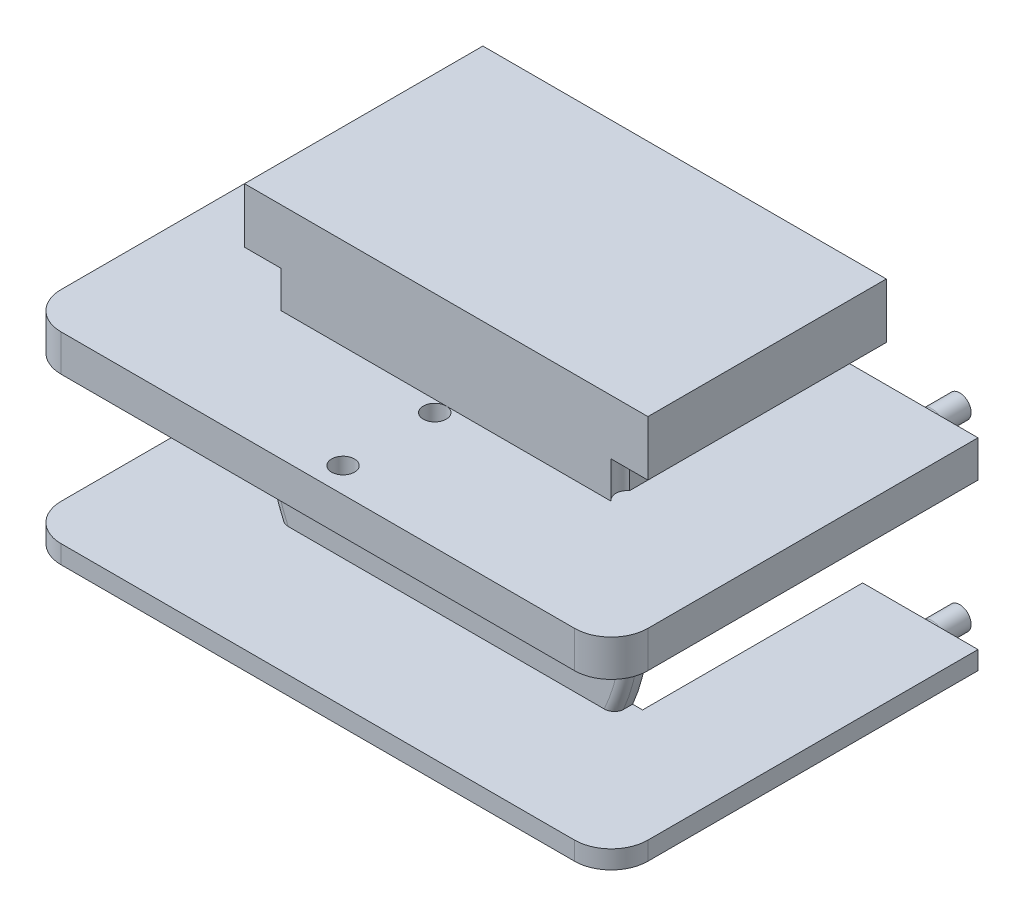
from build123d import *

# Parameters (mm, degrees)
BOSS_EXTRUDE1_DEPTH     = 1
SKETCH2_R               = 1.475
BOSS_EXTRUDE2_DEPTH     = 14
SKETCH3_R               = 1.8
BOSS_EXTRUDE3_DEPTH     = 0.75
SKETCH4_W               = 2
SKETCH4_H               = 17
BOSS_EXTRUDE4_DEPTH     = 12
SKETCH5_W               = 18
SKETCH5_H               = 2
BOSS_EXTRUDE5_DEPTH     = 12
SKETCH6_W               = 13
SKETCH6_H               = 2
BOSS_EXTRUDE6_DEPTH     = 5
BOSS_EXTRUDE7_DEPTH     = 12
CUT_EXTRUDE1_DEPTH      = 24.366642891
SKETCH9_W               = 2.937742252
SKETCH9_H               = 8
CUT_EXTRUDE2_DEPTH      = 12
CUT_EXTRUDE11_START     = -12
SKETCH21_R              = 10.5
SKETCH21_R_2            = 1.8
CUT_EXTRUDE11_DEPTH     = 12
SKETCH10_W              = 32
SKETCH10_H              = 2
BOSS_EXTRUDE8_DEPTH     = 7
FILLET1_R               = 0.5
SKETCH11_R              = 0.625
BOSS_EXTRUDE9_DEPTH     = 2
SKETCH14_W              = 2
SKETCH14_H              = 2
CUT_EXTRUDE5_DEPTH      = 28.874719859
SKETCH12_R              = 0.675
CUT_EXTRUDE3_DEPTH      = 2.5
CUT_EXTRUDE6_DEPTH      = 2
FILLET2_R               = 0.5
FILLET3_R               = 0.5
FILLET4_R               = 2
CUT_EXTRUDE7_DEPTH      = 28.221315288
CUT_EXTRUDE7_DEPTH_BACK = 1
SKETCH19_R              = 0.625
CUT_EXTRUDE9_DEPTH      = 2
FILLET5_R               = 0.4


with BuildPart() as part:
    # Sketch1 → Boss-Extrude1 (new body)
    with BuildSketch(Plane.XY):
        Polygon((-11, 6), (-11, 11), (11, 11), (11, 6), (11, -6), (-11, -6), align=None)
    extrude(amount=BOSS_EXTRUDE1_DEPTH)

    # Sketch2 → Boss-Extrude2 (add)
    with BuildSketch(Plane(origin=(0, 0, 0), x_dir=(-1, 0, 0), z_dir=(0, 0, -1))):
        with Locations(Location((0, 0, 0), (0, 0, 180))):
            Circle(SKETCH2_R)
    extrude(amount=BOSS_EXTRUDE2_DEPTH)

    # Sketch3 → Boss-Extrude3 (add)
    with BuildSketch(Plane(origin=(0, 0, 0), x_dir=(-1, 0, 0), z_dir=(0, 0, -1))):
        with Locations(Location((0, 0, 0), (0, 0, 180))):
            Circle(SKETCH3_R)
    extrude(amount=BOSS_EXTRUDE3_DEPTH)

    # Sketch4 → Boss-Extrude4 (add)
    with BuildSketch(Plane(origin=(0, 0, 0), x_dir=(-1, 0, 0), z_dir=(0, 0, -1))):
        with Locations((10, 2.5)):
            Rectangle(SKETCH4_W, SKETCH4_H)
        with Locations((-10, 2.5)):
            Rectangle(SKETCH4_W, SKETCH4_H)
    extrude(amount=BOSS_EXTRUDE4_DEPTH)

    # Sketch5 → Boss-Extrude5 (add)
    with BuildSketch(Plane(origin=(0, 0, 0), x_dir=(-1, 0, 0), z_dir=(0, 0, -1))):
        with Locations((0, 10)):
            Rectangle(SKETCH5_W, SKETCH5_H)
    extrude(amount=BOSS_EXTRUDE5_DEPTH)

    # Sketch6 → Boss-Extrude6 (add)
    with BuildSketch(Plane(origin=(11, 0, 0), x_dir=(0, 0, -1), z_dir=(1, 0, 0))):
        with Locations((5.5, -5)):
            Rectangle(SKETCH6_W, SKETCH6_H)
        with Locations((5.5, 5)):
            Rectangle(SKETCH6_W, SKETCH6_H)
    boss_extrude6 = extrude(amount=BOSS_EXTRUDE6_DEPTH)

    # Mirror1: Boss-Extrude6 across plane
    add(boss_extrude6.mirror(Plane(origin=(0, 0, 0), x_dir=(0, 0, 1), z_dir=(1, 0, 0))))

    # Sketch7 → Boss-Extrude7 (add)
    with BuildSketch(Plane(origin=(0, 0, -12), x_dir=(-1, 0, 0), z_dir=(0, 0, -1))):
        with BuildLine():
            ThreePointArc((-6.708203932, -6), (-8.407551231, -3.211398808), (-9, 0))
            Line((-9, 0), (-9, -6))
            Line((-9, -6), (-6.708203932, -6))
        make_face()
        with BuildLine():
            Line((-9, 9), (-9, 0))
            ThreePointArc((-9, 0), (-6.363961031, 6.363961031), (0, 9))
            Line((0, 9), (-9, 9))
        make_face()
    boss_extrude7 = extrude(amount=-BOSS_EXTRUDE7_DEPTH)

    # Sketch8 → Cut-Extrude1 (cut, through all)
    with BuildSketch(Plane(origin=(0, 0, -12), x_dir=(-1, 0, 0), z_dir=(0, 0, -1))):
        with BuildLine():
            Line((-11, 4), (-9.16515139, 4))
            ThreePointArc((-9.16515139, 4), (-10, 0), (-9.16515139, -4))
            Line((-9.16515139, -4), (-11, -4))
            Line((-11, -4), (-11, 4))
        make_face()
    cut_extrude1 = extrude(amount=-CUT_EXTRUDE1_DEPTH, mode=Mode.SUBTRACT)

    # Sketch9 → Cut-Extrude2 (cut)
    with BuildSketch(Plane(origin=(0, 0, -12), x_dir=(-1, 0, 0), z_dir=(0, 0, -1))):
        with Locations((-9.531128874, 0)):
            Rectangle(SKETCH9_W, SKETCH9_H)
    cut_extrude2 = extrude(amount=-CUT_EXTRUDE2_DEPTH, mode=Mode.SUBTRACT)

    # Mirror2: Boss-Extrude7, Cut-Extrude1, Cut-Extrude2 across plane
    add(boss_extrude7.mirror(Plane(origin=(0, 0, 0), x_dir=(0, 0, 1), z_dir=(1, 0, 0))))
    add(cut_extrude1.mirror(Plane(origin=(0, 0, 0), x_dir=(0, 0, 1), z_dir=(1, 0, 0))), mode=Mode.SUBTRACT)
    add(cut_extrude2.mirror(Plane(origin=(0, 0, 0), x_dir=(0, 0, 1), z_dir=(1, 0, 0))), mode=Mode.SUBTRACT)

    # Sketch21 → Cut-Extrude11 (cut)
    with BuildSketch(Plane(origin=(0, 0, -12), x_dir=(-1, 0, 0), z_dir=(0, 0, -1)).offset(CUT_EXTRUDE11_START)):
        Circle(SKETCH21_R)
        with Locations(Location((0, 0, 0), (0, 0, 180))):
            Circle(SKETCH21_R_2, mode=Mode.SUBTRACT)
    extrude(amount=CUT_EXTRUDE11_DEPTH, mode=Mode.SUBTRACT)

    # Sketch10 → Boss-Extrude8 (add)
    with BuildSketch(Plane.XY.offset(1)):
        with Locations((0, -5)):
            Rectangle(SKETCH10_W, SKETCH10_H)
        with Locations((0, 5)):
            Rectangle(SKETCH10_W, SKETCH10_H)
    extrude(amount=BOSS_EXTRUDE8_DEPTH)

    # Fillet1
    fillet1_edges = [part.edges().sort_by_distance(p)[0] for p in [
        (10, 0, 1),
        (-10, 0, 1),
    ]]
    fillet(fillet1_edges, radius=FILLET1_R)

    # Sketch11 → Boss-Extrude9 (add)
    with BuildSketch(Plane(origin=(0, 0, -12), x_dir=(-1, 0, 0), z_dir=(0, 0, -1))):
        with Locations(Location((-13, -5, 0), (0, 0, 180))):
            Circle(SKETCH11_R)
    boss_extrude9 = extrude(amount=BOSS_EXTRUDE9_DEPTH)

    # Sketch14 → Cut-Extrude5 (cut, through all)
    with BuildSketch(Plane(origin=(0, 0, -12), x_dir=(-1, 0, 0), z_dir=(0, 0, -1))):
        with Locations((10, 7)):
            Rectangle(SKETCH14_W, SKETCH14_H)
        with Locations((-10, 7)):
            Rectangle(SKETCH14_W, SKETCH14_H)
    extrude(amount=-CUT_EXTRUDE5_DEPTH, mode=Mode.SUBTRACT)

    # Sketch12 → Cut-Extrude3 (cut)
    with BuildSketch(Plane(origin=(0, 0, -12), x_dir=(-1, 0, 0), z_dir=(0, 0, -1))):
        with Locations((13, -5)):
            Circle(SKETCH12_R)
    cut_extrude3 = extrude(amount=-CUT_EXTRUDE3_DEPTH, mode=Mode.SUBTRACT)

    # Sketch16 → Cut-Extrude6 (cut)
    with BuildSketch(Plane(origin=(0, 6, 0), x_dir=(1, 0, 0), z_dir=(0, 1, 0))):
        with BuildLine():
            Line((-9, 0), (-9, -1))
            ThreePointArc((-9, -1), (-8.75, -0.5), (-9, 0))
        make_face()
    cut_extrude6 = extrude(amount=CUT_EXTRUDE6_DEPTH, mode=Mode.SUBTRACT)

    # Mirror3: Boss-Extrude9, Cut-Extrude3 across plane
    add(boss_extrude9.mirror(Plane.ZX))
    add(cut_extrude3.mirror(Plane.ZX), mode=Mode.SUBTRACT)

    # Mirror4: Cut-Extrude6 across plane
    add(cut_extrude6.mirror(Plane(origin=(0, 0, 0), x_dir=(0, 0, 1), z_dir=(1, 0, 0))), mode=Mode.SUBTRACT)

    # Fillet2
    fillet2_edges = [part.edges().sort_by_distance(p)[0] for p in [
        (12.375, -5, -12),
        (12.375, 5, -12),
    ]]
    fillet(fillet2_edges, radius=FILLET2_R)

    # Fillet3
    # the kernel refuses this fillet: 0.5 mm, written as the material it takes off along each edge
    with BuildSketch(Plane(origin=(-13, -5, -12), x_dir=(-1, 0, 0), z_dir=(0, -1, 0))) as fillet3_piece_1:
        with BuildLine():
            CenterArc((0.675 + FILLET3_R, -FILLET3_R), FILLET3_R, 90, 90)
            Line((0.675, -FILLET3_R), (0.675, 0))
            Line((0.675, 0), (0.675 + FILLET3_R, 0))
        make_face()
    revolve(axis=Axis((-13, -5, -12), (0, 0, -1)), mode=Mode.SUBTRACT)
    with BuildSketch(Plane(origin=(-13, 5, -12), x_dir=(-1, 0, 0), z_dir=(0, 1, 0))) as fillet3_piece_2:
        with BuildLine():
            CenterArc((0.675 + FILLET3_R, FILLET3_R), FILLET3_R, 180, 90)
            Line((0.675, FILLET3_R), (0.675, 0))
            Line((0.675, 0), (0.675 + FILLET3_R, 0))
        make_face()
    revolve(axis=Axis((-13, 5, -12), (0, 0, 1)), mode=Mode.SUBTRACT)

    # Fillet4
    fillet4_edges = [part.edges().sort_by_distance(p)[0] for p in [
        (16, -5, 8),
        (-16, -5, 8),
        (-16, 5, 8),
        (16, 5, 8),
    ]]
    fillet(fillet4_edges, radius=FILLET4_R)

    # Sketch17 → Cut-Extrude7 (cut, two sides: drawn at the far end of the back side and taken through both)
    with BuildSketch(Plane.XZ.offset(6).offset(-CUT_EXTRUDE7_DEPTH_BACK)):
        with BuildLine():
            Line((-16, 6), (-16, -12))
            Line((-16, -12), (-14.5, -12))
            Line((-14.5, -12), (-14.5, 6))
            ThreePointArc((-14.5, 6), (-14.353553391, 6.353553391), (-14, 6.5))
            Line((-14, 6.5), (14, 6.5))
            ThreePointArc((14, 6.5), (14.353553391, 6.353553391), (14.5, 6))
            Line((14.5, 6), (14.5, -12))
            Line((14.5, -12), (16, -12))
            Line((16, -12), (16, 6))
            ThreePointArc((16, 6), (15.414213562, 7.414213562), (14, 8))
            Line((14, 8), (-14, 8))
            ThreePointArc((-14, 8), (-15.414213562, 7.414213562), (-16, 6))
        make_face()
    extrude(amount=CUT_EXTRUDE7_DEPTH + CUT_EXTRUDE7_DEPTH_BACK, mode=Mode.SUBTRACT)

    # Sketch19 → Cut-Extrude9 (cut)
    with BuildSketch(Plane(origin=(0, 6, 0), x_dir=(1, 0, 0), z_dir=(0, 1, 0))):
        with Locations(Location((0, -1.625, 0), (0, 0, 90))):
            Circle(SKETCH19_R)
        with Locations(Location((0, -6.625, 0), (0, 0, 270))):
            Circle(SKETCH19_R)
    extrude(amount=-CUT_EXTRUDE9_DEPTH, mode=Mode.SUBTRACT)

    # Fillet5
    fillet5_edges = [part.edges().sort_by_distance(p)[0] for p in [
        (-1.475, 0, -14),
    ]]
    fillet(fillet5_edges, radius=FILLET5_R)


solid = part.part
